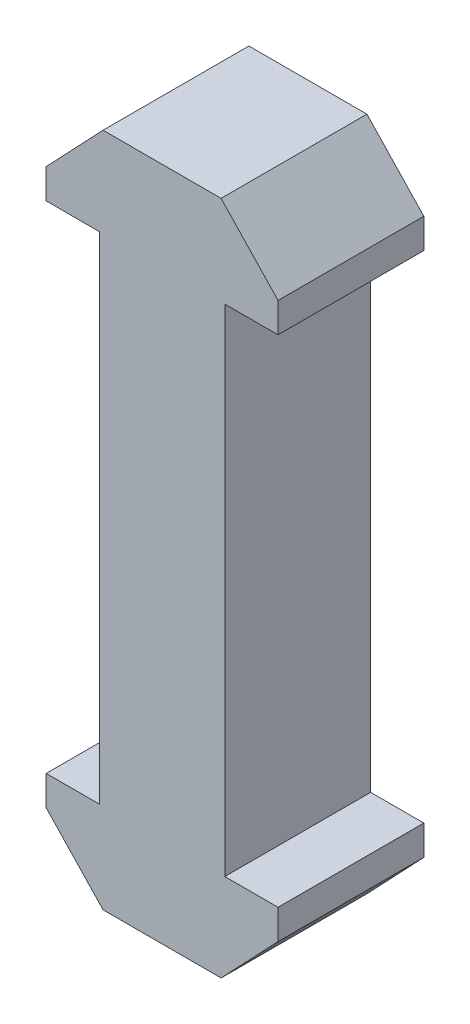
from build123d import *

# Parameters (mm, degrees)
BOSS_EXTRUDE1_DEPTH = 5


with BuildPart() as part:
    # Sketch1 → Boss-Extrude1 (new, symmetric)
    with BuildSketch(Plane.XY):
        Polygon((4.3, -2.122480699), (4.3, 31.877519301), (7.95, 31.877519301), (7.95, 33.917519301), (4.048, 38.029934285), (-4.048, 38.029934285), (-7.95, 33.917519301), (-7.95, 31.877519301), (-4.3, 31.877519301), (-4.3, -2.122480699), (-7.95, -2.122480699), (-7.95, -4.162480699), (-4.048, -8.274895683), (4.048, -8.274895683), (7.95, -4.162480699), (7.95, -2.122480699), align=None)
    extrude(amount=BOSS_EXTRUDE1_DEPTH, both=True)


solid = part.part
